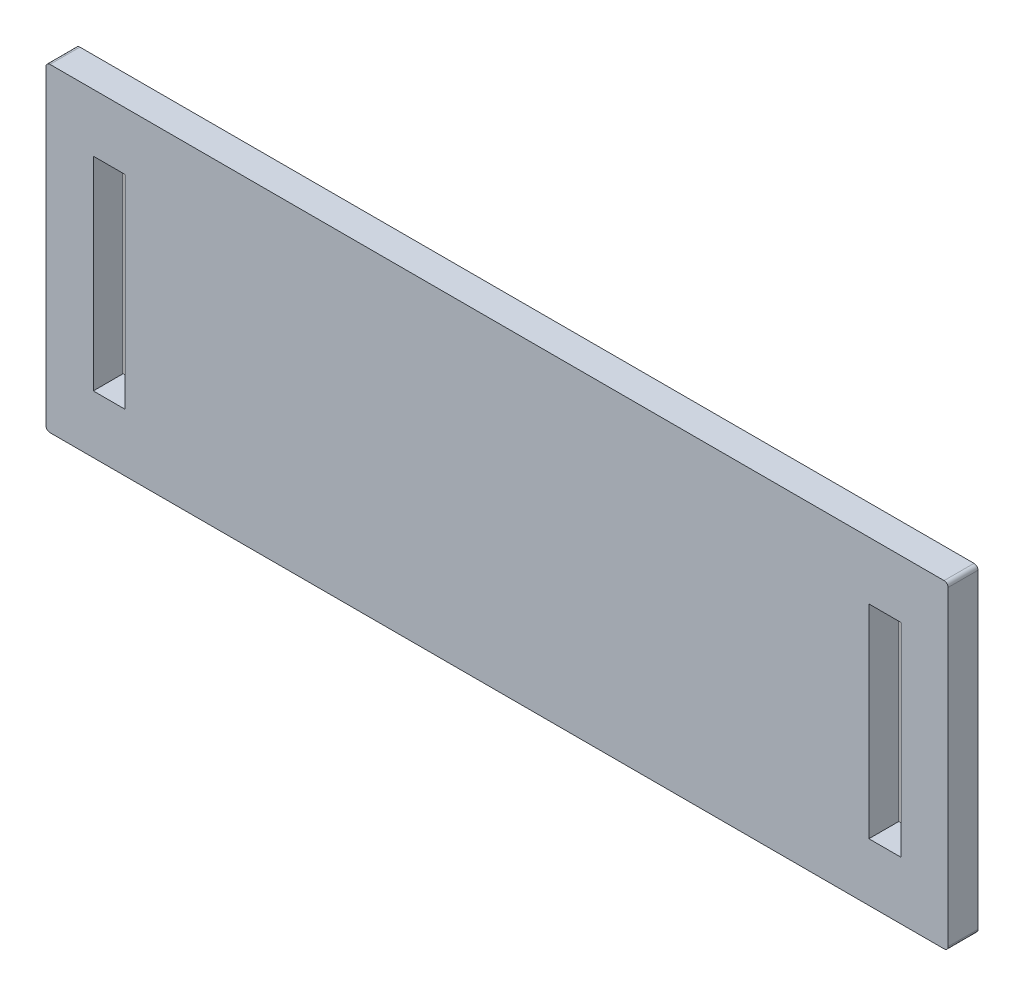
from build123d import *

# Parameters (mm, degrees)
SKETCH1_W          = 1.6
SKETCH1_H          = 10.2
BASE_FLANGE1_DEPTH = 1.5


# Sheet-metal steps are written as plain solids
with BuildPart() as part:
    # Sketch1 → Base-Flange1 (new body)
    with BuildSketch(Plane.XY):
        with BuildLine():
            Line((0.2, 0), (45.05, 0))
            ThreePointArc((45.05, 0), (45.191421356, 0.058578644), (45.25, 0.2))
            Line((45.25, 0.2), (45.25, 15.8))
            ThreePointArc((45.25, 15.8), (45.191421356, 15.941421356), (45.05, 16))
            Line((45.05, 16), (0.2, 16))
            ThreePointArc((0.2, 16), (0.058578644, 15.941421356), (0, 15.8))
            Line((0, 15.8), (0, 0.2))
            ThreePointArc((0, 0.2), (0.058578644, 0.058578644), (0.2, 0))
        make_face()
        with Locations((3.172093023, 8)):
            Rectangle(SKETCH1_W, SKETCH1_H, mode=Mode.SUBTRACT)
        with Locations((42.077906977, 8)):
            Rectangle(SKETCH1_W, SKETCH1_H, mode=Mode.SUBTRACT)
    extrude(amount=-BASE_FLANGE1_DEPTH)


solid = part.part
